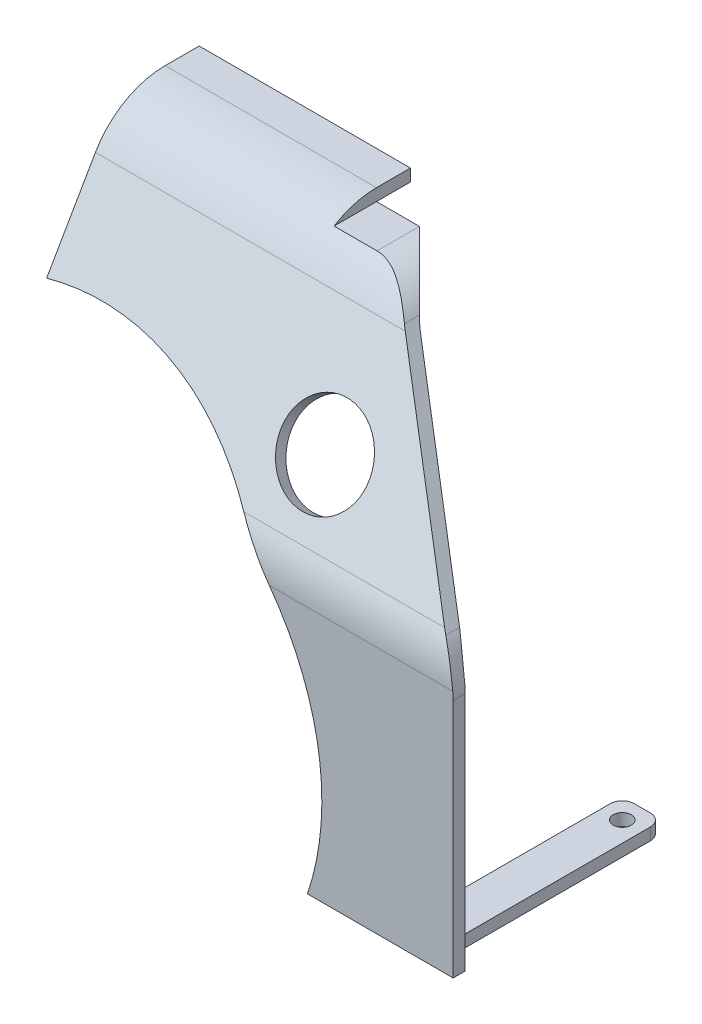
from build123d import *

# Parameters (mm, degrees)
SALIENTE_EXTRUIR1_DEPTH = 58.05
REDONDEO1_R             = 20
REDONDEO2_R             = 20
REDONDEO3_R             = 17
REDONDEO4_R             = 17
CAVIDAD1_START          = -47
CAVIDAD1_DEPTH          = 50
CROQUIS8_W              = 10
CROQUIS8_H              = 3
SALIENTE_EXTRUIR2_DEPTH = 50
CROQUIS9_R              = 2.25
CORTAR_EXTRUIR6_DEPTH   = 136.665712106
SALIENTE_EXTRUIR3_REACH = 146.947
CROQUIS11_W             = 20
CROQUIS11_H             = 3
CROQUIS12_W             = 69.238292886
CROQUIS12_H             = 3
CORTAR_EXTRUIR7_DEPTH   = 1
CROQUIS15_R             = 1.75
CORTAR_EXTRUIR10_DEPTH  = 5
REDONDEO5_R             = 7
REDONDEO6_R             = 3
CROQUIS16_R             = 67.5
CORTAR_EXTRUIR11_DEPTH  = 145.946782753
CROQUIS18_R             = 11
CORTAR_EXTRUIR12_DEPTH  = 146.081609054


# Read off the part's stored shape, not the designer's step: Cavidad1
with BuildPart() as part:
    # Croquis1 → Saliente-Extruir1 (new, symmetric)
    with BuildSketch(Plane(origin=(0, 0, 0), x_dir=(0, 0, -1), z_dir=(1, 0, 0))):
        Polygon((0, 0), (0, 67.196152423), (28.732050808, 116.961524227), (47, 116.961524227), (47, 119.961524227), (27, 119.961524227), (-3, 68), (-3, 0), align=None)
    extrude(amount=SALIENTE_EXTRUIR1_DEPTH, both=True)

    # Redondeo1
    redondeo1_edges = [part.edges().sort_by_distance(p)[0] for p in [
        (0, 68, 3),
    ]]
    fillet(redondeo1_edges, radius=REDONDEO1_R)

    # Redondeo2
    redondeo2_edges = [part.edges().sort_by_distance(p)[0] for p in [
        (0, 119.961524227, -27),
    ]]
    fillet(redondeo2_edges, radius=REDONDEO2_R)

    # Redondeo3
    redondeo3_edges = [part.edges().sort_by_distance(p)[0] for p in [
        (0, 116.961524227, -28.732050808),
    ]]
    fillet(redondeo3_edges, radius=REDONDEO3_R)

    # Redondeo4
    redondeo4_edges = [part.edges().sort_by_distance(p)[0] for p in [
        (0, 67.196152423, 0),
    ]]
    fillet(redondeo4_edges, radius=REDONDEO4_R)

    # Cavidad1 outline → Cavidad1 (cut)
    with BuildSketch(Plane.XY.offset(CAVIDAD1_START)):
        with BuildLine():
            Line((58.05, 0), (58.05, 119.961524227))
            Line((58.05, 119.961524227), (-5.55, 119.961524227))
            Line((-5.55, 119.961524227), (-5.55, 116.961524227))
            Line((-5.55, 116.961524227), (5.123846837, 116.961524227))
            ThreePointArc((5.123846837, 116.961524227), (12.308357287, 115.368756607), (18.14660237, 110.888913592))
            Line((18.14660237, 110.888913592), (51.073651347, 71.647984679))
            ThreePointArc((51.073651347, 71.647984679), (54.025670368, 66.534937751), (55.050895814, 60.720595315))
            Line((55.050895814, 60.720595315), (55.050895814, 0))
            Line((55.050895814, 0), (58.05, 0))
        make_face()
    extrude(amount=CAVIDAD1_DEPTH, mode=Mode.SUBTRACT)

    # Croquis8 → Saliente-Extruir2 (add)
    with BuildSketch(Plane(origin=(0, 0, 0), x_dir=(-1, 0, 0), z_dir=(0, 0, -1))):
        with Locations((-49.050895814, 6.5)):
            Rectangle(CROQUIS8_W, CROQUIS8_H)
    extrude(amount=SALIENTE_EXTRUIR2_DEPTH)

    # Croquis9 → Cortar-Extruir6 (cut, through all)
    with BuildSketch(Plane(origin=(0, 8, 0), x_dir=(1, 0, 0), z_dir=(0, 1, 0))):
        with Locations(Location((49.050895814, 45, 0), (0, 0, 180))):
            Circle(CROQUIS9_R)
    extrude(amount=-CORTAR_EXTRUIR6_DEPTH, mode=Mode.SUBTRACT)

    # Saliente-Extruir3: up to this plane
    saliente_extruir3_end = Plane(origin=(58.05, 67.196152423, 0), z_dir=(0, 0.49999999999999767, 0.86602540378444))
    # Croquis11 → Saliente-Extruir3 (add, up to the surface)
    with BuildSketch(Plane(origin=(0, 0, -54), x_dir=(-1, 0, 0), z_dir=(0, 0, -1)), mode=Mode.PRIVATE) as saliente_extruir3_sk1:
        with Locations((28.05, 92.461524227)):
            Rectangle(CROQUIS11_W, CROQUIS11_H)
    saliente_extruir3_tool1 = split(extrude(saliente_extruir3_sk1.sketch, amount=-SALIENTE_EXTRUIR3_REACH, mode=Mode.PRIVATE), bisect_by=saliente_extruir3_end, keep=Keep.BOTH, mode=Mode.PRIVATE)
    add(saliente_extruir3_tool1.solids().sort_by_distance((-28.05, 92.461524, -54))[0])

    # Croquis12 → Cortar-Extruir7 (cut)
    with BuildSketch(Plane.XZ):
        with Locations((20.431749371, 1.5)):
            Rectangle(CROQUIS12_W, CROQUIS12_H)
    extrude(amount=-CORTAR_EXTRUIR7_DEPTH, mode=Mode.SUBTRACT)

    # Croquis15 → Cortar-Extruir10 (cut)
    with BuildSketch(Plane.XZ.offset(-90.961524227)):
        with Locations(Location((-28.049104186, -49.5, 0), (0, 0, 270))):
            Circle(CROQUIS15_R)
    extrude(amount=-CORTAR_EXTRUIR10_DEPTH, mode=Mode.SUBTRACT)

    # Redondeo5
    redondeo5_edges = [part.edges().sort_by_distance(p)[0] for p in [
        (-18.05, 92.461524227, -54),
        (-38.05, 92.461524227, -54),
    ]]
    fillet(redondeo5_edges, radius=REDONDEO5_R)

    # Redondeo6
    redondeo6_edges = [part.edges().sort_by_distance(p)[0] for p in [
        (54.050895814, 6.5, -50),
        (44.050895814, 6.5, -50),
    ]]
    fillet(redondeo6_edges, radius=REDONDEO6_R)

    # Croquis16 → Cortar-Extruir11 (cut, through all)
    with BuildSketch(Plane.XY.offset(3)):
        with Locations((-45.071920691, 22.721524227)):
            Circle(CROQUIS16_R)
    extrude(amount=-CORTAR_EXTRUIR11_DEPTH, mode=Mode.SUBTRACT)

    # Croquis18 → Cortar-Extruir12 (cut, through all)
    with BuildSketch(Plane(origin=(0, 18.299038106, 31.694863729), x_dir=(1, 0, 0), z_dir=(0, 0.4999999999999976, 0.86602540378444))):
        with Locations(Location((12.350895814, 79.099876042, 0), (0, 0, 270))):
            Circle(CROQUIS18_R)
    extrude(amount=-CORTAR_EXTRUIR12_DEPTH, mode=Mode.SUBTRACT)


solid = part.part
